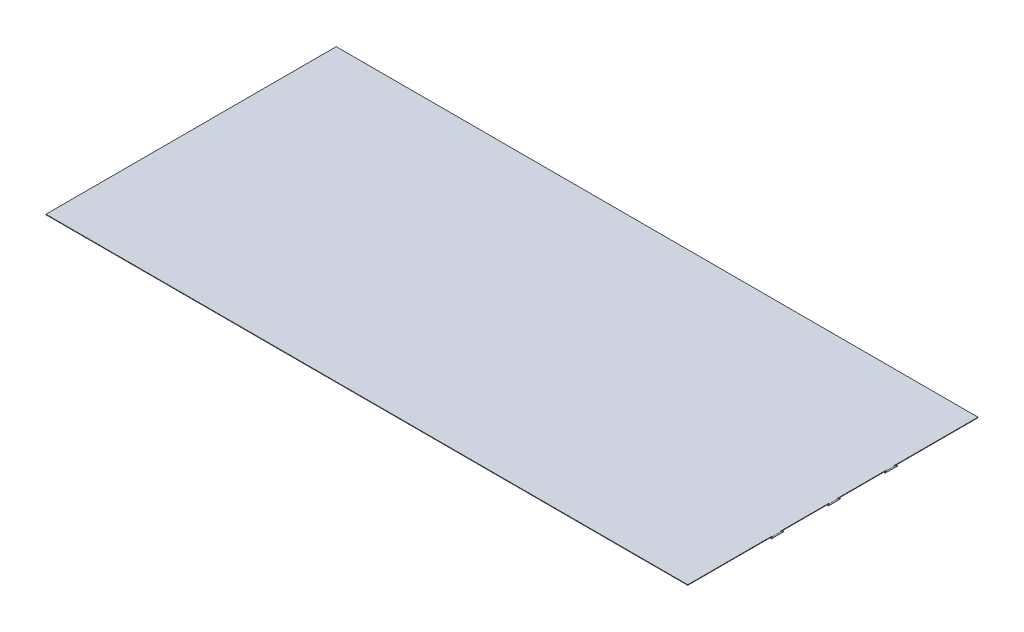
from build123d import *
from build123d.topology import SkipClean

# Parameters (mm, degrees)
SKETCH1_W               = 6088
SKETCH1_H               = 2753.2
BOSS_EXTRUDE1_DEPTH     = 5
SKETCH2_W               = 80
SKETCH2_H               = 5
BOSS_EXTRUDE2_DEPTH     = 10
SKETCH3_R               = 5
BOSS_EXTRUDE3_DEPTH     = 80
BOSS_EXTRUDE4_START     = 10
SKETCH4_R               = 5
BOSS_EXTRUDE4_DEPTH     = 10
SKETCH5_R               = 6
BOSS_EXTRUDE5_DEPTH     = 5
LPATTERN3_START         = -595
LPATTERN3_OUTLINE_R     = 5
LPATTERN3_DEPTH         = 105
LPATTERN3_2_OUTLINE_R   = 6
LPATTERN3_2_OUTLINE_R_2 = 5
LPATTERN3_2_DEPTH       = 5
LPATTERN4_START         = 485
LPATTERN4_OUTLINE_R     = 5
LPATTERN4_DEPTH         = 105
LPATTERN4_2_OUTLINE_R   = 6
LPATTERN4_2_OUTLINE_R_2 = 5
LPATTERN4_2_DEPTH       = 5
LPATTERN5_COUNT         = 2
LPATTERN5_PITCH         = 540


# Read off the part's stored shape, not the designer's step: LPattern3, LPattern4
with BuildPart() as part:
    # Sketch1 → Boss-Extrude1 (new body)
    with BuildSketch(Plane(origin=(0, 0, 0), x_dir=(1, 0, 0), z_dir=(0, 1, 0))):
        Rectangle(SKETCH1_W, SKETCH1_H)
    extrude(amount=BOSS_EXTRUDE1_DEPTH)

    # Sketch2 → Boss-Extrude2 (add)
    with BuildSketch(Plane(origin=(3044, 0, 0), x_dir=(0, 0, -1), z_dir=(1, 0, 0))):
        with Locations((0, 2.5)):
            Rectangle(SKETCH2_W, SKETCH2_H)
        with Locations((540, 2.5)):
            Rectangle(SKETCH2_W, SKETCH2_H)
        with Locations((-540, 2.5)):
            Rectangle(SKETCH2_W, SKETCH2_H)
    extrude(amount=BOSS_EXTRUDE2_DEPTH)

    # Sketch3 → Boss-Extrude3 (add)
    with BuildSketch(Plane.XY.offset(40)):
        with Locations((3054, 2.5)):
            Circle(SKETCH3_R)
    extrude(amount=-BOSS_EXTRUDE3_DEPTH)

    # Sketch4 → Boss-Extrude4 (add)
    with BuildSketch(Plane.XY.offset(40).offset(BOSS_EXTRUDE4_START)):
        with Locations((3054, 2.5)):
            Circle(SKETCH4_R)
    boss_extrude4 = extrude(amount=-BOSS_EXTRUDE4_DEPTH)

    # Sketch5 → Boss-Extrude5 (add)
    with BuildSketch(Plane.XY.offset(50)):
        with Locations((3054, 2.5)):
            Circle(SKETCH5_R)
    boss_extrude5 = extrude(amount=BOSS_EXTRUDE5_DEPTH)

    # Mirror1: Boss-Extrude4, Boss-Extrude5 across plane
    with SkipClean():  # the faces are left unmerged after this step: merging them gives an invalid solid
        add(boss_extrude4.mirror(Plane.XY))
        add(boss_extrude5.mirror(Plane.XY))

    # LPattern3 outline → LPattern3 (add)
    with BuildSketch(Plane.XY.offset(LPATTERN3_START)):
        with Locations((3054, 2.5)):
            Circle(LPATTERN3_OUTLINE_R)
    extrude(amount=LPATTERN3_DEPTH)

    # LPattern3 2 outline → LPattern3 2 (add)
    with BuildSketch(Plane.XY.offset(LPATTERN3_START)):
        with Locations((3054, 2.5)):
            Circle(LPATTERN3_2_OUTLINE_R)
        with Locations((3054, 2.5)):
            Circle(LPATTERN3_2_OUTLINE_R_2, mode=Mode.SUBTRACT)
    extrude(amount=LPATTERN3_2_DEPTH)

    # LPattern4 outline → LPattern4 (add)
    with BuildSketch(Plane.XY.offset(LPATTERN4_START)):
        with Locations((3054, 2.5)):
            Circle(LPATTERN4_OUTLINE_R)
    lpattern4 = extrude(amount=LPATTERN4_DEPTH)

    # LPattern4 2 outline → LPattern4 2 (add)
    with BuildSketch(Plane.XY.offset(LPATTERN4_START)):
        with Locations((3054, 2.5)):
            Circle(LPATTERN4_2_OUTLINE_R)
        with Locations((3054, 2.5)):
            Circle(LPATTERN4_2_OUTLINE_R_2, mode=Mode.SUBTRACT)
    lpattern4_2 = extrude(amount=LPATTERN4_2_DEPTH)

    # LPattern5: Boss-Extrude5 ×2
    with Locations(*[(0, 0, i * LPATTERN5_PITCH) for i in range(1, LPATTERN5_COUNT)]):
        add(boss_extrude5)

    # Mirror3: LPattern4, LPattern4 2 across plane
    add(lpattern4.mirror(Plane.XY))
    add(lpattern4_2.mirror(Plane.XY))


solid = part.part
